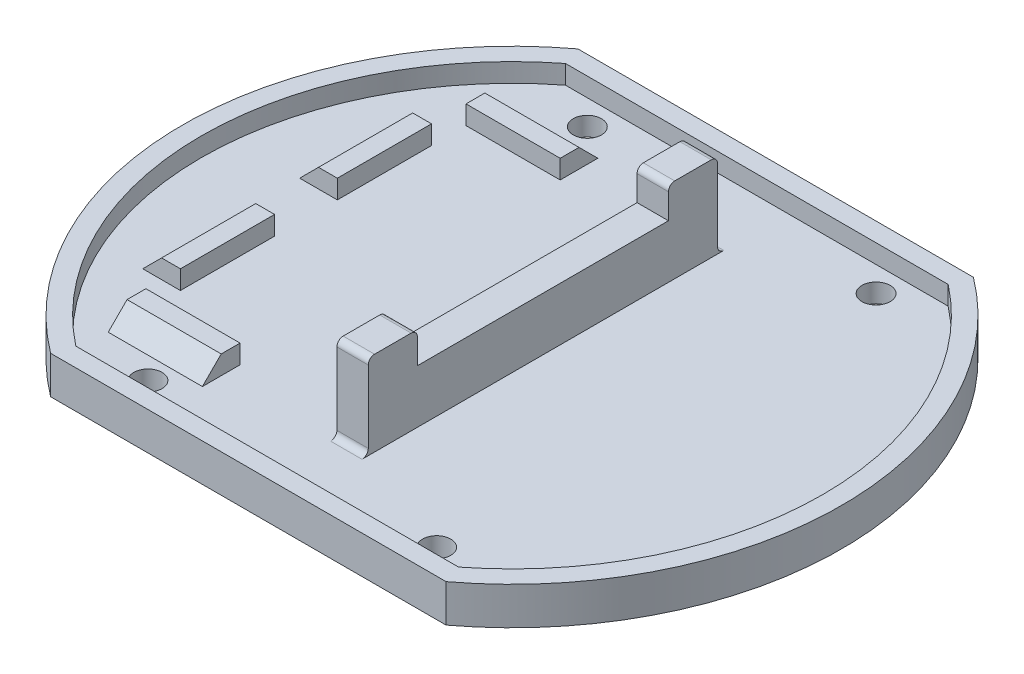
from build123d import *

# Parameters (mm, degrees)
A_BASE_T42_OUTLINE_R        = 2.2479
A_BASE_T42_OUTLINE_R_2      = 1
A_BASE_T42_DEPTH            = 3
OUTER_BRIM_DEPTH            = 3
SKETCH5_W                   = 3
SKETCH5_H                   = 15
SKETCH5_W_2                 = 15
SKETCH5_H_2                 = 3
BASE_SUPPORTS_DEPTH         = 3
BASE_SUPPORTS_CHAMFER_SIZE  = 3
COVER_START                 = -3
SKETCH6_R                   = 1
COVER_DEPTH                 = 3
SKETCH7_W                   = 5
SKETCH7_H                   = 55.64
SERVO_SIDE_SUPPORTS_DEPTH   = 8.5
SKETCH8_W                   = 5
SKETCH8_H                   = 7.82
SERVO_SIDE_EXTENSIONS_DEPTH = 5
SERVO_CONTOURING_R          = 1


# Read off the part's stored shape, not the designer's step: a_base_t42
with BuildPart() as part:
    # a_base_t42 outline → a_base_t42 (new body)
    with BuildSketch(Plane(origin=(0, 0, 0), x_dir=(1, 0, 0), z_dir=(0, 1, 0))):
        with BuildLine():
            ThreePointArc((31.5, -42), (52.5, 0), (31.5, 42))
            Line((31.5, 42), (-31.5, 42))
            ThreePointArc((-31.5, 42), (-52.5, 0), (-31.5, -42))
            Line((-31.5, -42), (31.5, -42))
        make_face()
        with Locations((-23, -35)):
            Circle(A_BASE_T42_OUTLINE_R, mode=Mode.SUBTRACT)
        with Locations((23, -35)):
            Circle(A_BASE_T42_OUTLINE_R, mode=Mode.SUBTRACT)
        with Locations((-40.25, 0)):
            Circle(A_BASE_T42_OUTLINE_R_2, mode=Mode.SUBTRACT)
        with Locations((-23, 35)):
            Circle(A_BASE_T42_OUTLINE_R, mode=Mode.SUBTRACT)
        with Locations((40.25, 0)):
            Circle(A_BASE_T42_OUTLINE_R_2, mode=Mode.SUBTRACT)
        with Locations((23, 35)):
            Circle(A_BASE_T42_OUTLINE_R, mode=Mode.SUBTRACT)
    extrude(amount=A_BASE_T42_DEPTH)

    # Sketch1 → Outer Brim (add)
    with BuildSketch(Plane(origin=(0, 3, 0), x_dir=(1, 0, 0), z_dir=(0, 1, 0))):
        with BuildLine():
            Line((-31.5, -42), (31.5, -42))
            ThreePointArc((31.5, -42), (52.5, 0), (31.5, 42))
            Line((31.5, 42), (-31.5, 42))
            ThreePointArc((-31.5, 42), (-52.5, 0), (-31.5, -42))
        make_face()
        with BuildLine():
            Line((30.483602149, 39), (-30.483602149, 39))
            ThreePointArc((-30.483602149, 39), (-49.5, 0), (-30.483602149, -39))
            Line((-30.483602149, -39), (30.483602149, -39))
            ThreePointArc((30.483602149, -39), (49.5, 0), (30.483602149, 39))
        make_face(mode=Mode.SUBTRACT)
    extrude(amount=OUTER_BRIM_DEPTH)

    # Sketch5 → Base Supports (add)
    with BuildSketch(Plane(origin=(0, 3, 0), x_dir=(1, 0, 0), z_dir=(0, 1, 0))):
        with Locations((-34.325, -12.5)):
            Rectangle(SKETCH5_W, SKETCH5_H)
        with Locations((-34.325, 12.5)):
            Rectangle(SKETCH5_W, SKETCH5_H)
        with Locations((-25.325, -27)):
            Rectangle(SKETCH5_W_2, SKETCH5_H_2)
        with Locations((-25.325, 27)):
            Rectangle(SKETCH5_W_2, SKETCH5_H_2)
    extrude(amount=BASE_SUPPORTS_DEPTH)

    # Base Supports Chamfer
    base_supports_chamfer_edges = [part.edges().sort_by_distance(p)[0] for p in [
        (-25.325, 3, 28.5),
        (-25.325, 3, -28.5),
        (-35.825, 3, 12.5),
        (-35.825, 3, -12.5),
    ]]
    chamfer(base_supports_chamfer_edges, length=BASE_SUPPORTS_CHAMFER_SIZE - 0.0001)  # a hair under: the kernel refuses the full size

    # Sketch6 → Cover (add)
    with BuildSketch(Plane(origin=(0, 3, 0), x_dir=(1, 0, 0), z_dir=(0, 1, 0)).offset(COVER_START)):
        with Locations((-40.25, 0)):
            Circle(SKETCH6_R)
        with Locations((40.25, 0)):
            Circle(SKETCH6_R)
    extrude(amount=COVER_DEPTH)

    # Sketch7 → Servo Side Supports (add)
    with BuildSketch(Plane(origin=(0, 3, 0), x_dir=(1, 0, 0), z_dir=(0, 1, 0))):
        with Locations((2.425, 0)):
            Rectangle(SKETCH7_W, SKETCH7_H)
    extrude(amount=SERVO_SIDE_SUPPORTS_DEPTH)

    # Sketch8 → Servo Side Extensions (add)
    with BuildSketch(Plane(origin=(0, 11.5, 0), x_dir=(1, 0, 0), z_dir=(0, 1, 0))):
        with Locations((2.425, 23.91)):
            Rectangle(SKETCH8_W, SKETCH8_H)
        with Locations((2.425, -23.91)):
            Rectangle(SKETCH8_W, SKETCH8_H)
    extrude(amount=SERVO_SIDE_EXTENSIONS_DEPTH)

    # Servo Contouring
    servo_contouring_edges = [part.edges().sort_by_distance(p)[0] for p in [
        (2.425, 3, -27.82),
        (2.425, 16.5, -27.82),
        (2.425, 3, 27.82),
        (2.425, 16.5, 27.82),
        (2.425, 16.5, 20),
        (2.425, 16.5, -20),
    ]]
    fillet(servo_contouring_edges, radius=SERVO_CONTOURING_R)


solid = part.part
